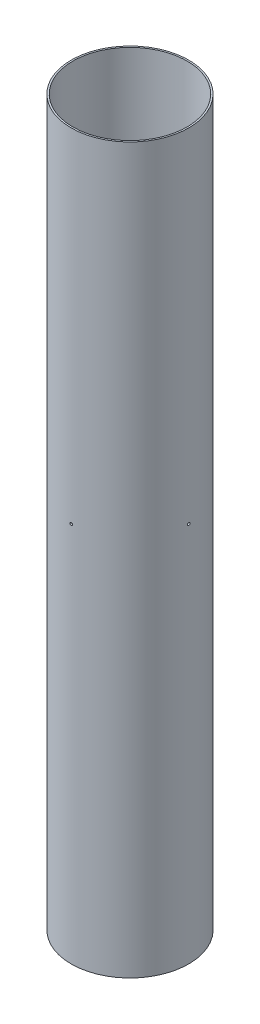
from build123d import *

# Parameters (mm, degrees)
SKETCH1_R           = 78.359
SKETCH1_R_2         = 76.1746
BOSS_EXTRUDE1_DEPTH = 965.2
SKETCH3_R           = 1.750000056
CUT_EXTRUDE1_DEPTH  = 972.540686622
CIRPATTERN1_COUNT   = 4


with BuildPart() as part:
    # Sketch1 → Boss-Extrude1 (new body)
    with BuildSketch(Plane(origin=(0, 0, 0), x_dir=(1, 0, 0), z_dir=(0, 1, 0))):
        Circle(SKETCH1_R)
        Circle(SKETCH1_R_2, mode=Mode.SUBTRACT)
    extrude(amount=BOSS_EXTRUDE1_DEPTH)

    # Sketch3 → Cut-Extrude1 (cut, through all)
    with BuildSketch(Plane.XY):
        with Locations((0, 508)):
            Circle(SKETCH3_R)
    cut_extrude1 = extrude(amount=-CUT_EXTRUDE1_DEPTH, mode=Mode.SUBTRACT)

    # CirPattern1: Cut-Extrude1 ×4 about axis
    cirpattern1_axis = Axis((0, 965.2, 0), (0, -1, 0))
    for i in range(1, CIRPATTERN1_COUNT):
        add(cut_extrude1.rotate(cirpattern1_axis, i * 360 / CIRPATTERN1_COUNT), mode=Mode.SUBTRACT)


solid = part.part
